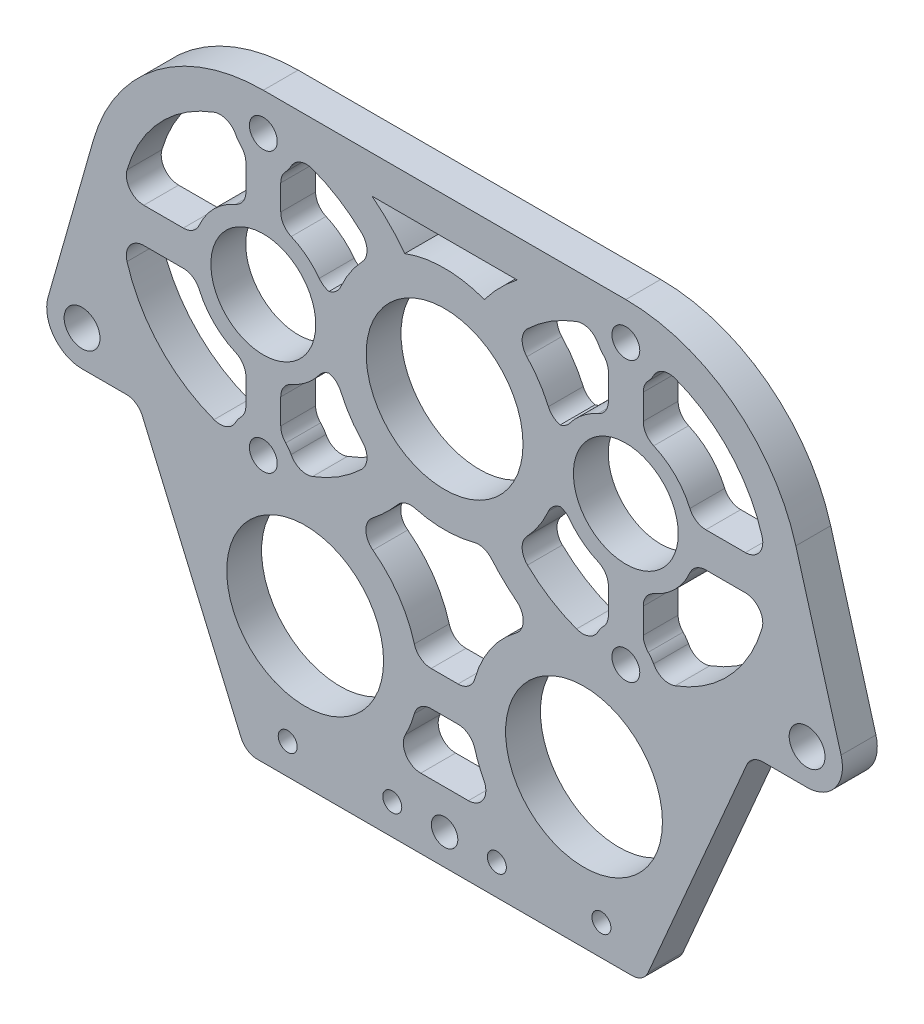
from build123d import *

# Parameters (mm, degrees)
SKETCH1_R           = 9.5504
SKETCH1_R_2         = 2.54
SKETCH1_R_3         = 3.2639
SKETCH1_R_4         = 14.2875
SKETCH1_R_5         = 1.7272
SKETCH1_R_6         = 2.413
BOSS_EXTRUDE1_DEPTH = 6.35
FILLET1_R           = 3.175
FILLET2_R           = 3.175
FILLET3_R           = 3.175


with BuildPart() as part:
    # Sketch1 → Boss-Extrude1 (new body)
    with BuildSketch(Plane.XY):
        with BuildLine():
            Line((-88.729603024, -57.047479146), (-96.969555254, -85.936940817))
            ThreePointArc((-96.969555254, -85.936940817), (-95.917203646, -91.581675778), (-90.777596546, -94.141932707))
            Line((-90.777596546, -94.141932707), (-82.731084461, -94.141932707))
            ThreePointArc((-82.731084461, -94.141932707), (-81.056984084, -94.611428847), (-79.87115572, -95.882982931))
            Line((-79.87115572, -95.882982931), (-60.977424177, -139.773032707))
            Line((-60.977424177, -139.773032707), (11.502231084, -139.773032707))
            Line((11.502231084, -139.773032707), (30.395962627, -95.882982931))
            ThreePointArc((30.395962627, -95.882982931), (31.581790992, -94.611428847), (33.255891369, -94.141932707))
            Line((33.255891369, -94.141932707), (41.302403454, -94.141932707))
            ThreePointArc((41.302403454, -94.141932707), (46.442010554, -91.581675778), (47.494362162, -85.936940817))
            Line((47.494362162, -85.936940817), (39.254409932, -57.047479146))
            ThreePointArc((39.254409932, -57.047479146), (39.214953717, -56.910298001), (39.174889904, -56.773293074))
            ThreePointArc((39.174889904, -56.773293074), (27.569139848, -40.087517091), (8.282403454, -33.674222013))
            Line((8.282403454, -33.674222013), (-57.757596546, -33.674222013))
            ThreePointArc((-57.757596546, -33.674222013), (-77.04433294, -40.087517091), (-88.650082996, -56.773293074))
            ThreePointArc((-88.650082996, -56.773293074), (-88.69014681, -56.910298001), (-88.729603024, -57.047479146))
        make_face()
        with Locations((-57.757596546, -65.881422013)):
            Circle(SKETCH1_R, mode=Mode.SUBTRACT)
        with Locations((-57.757596546, -40.481422013)):
            Circle(SKETCH1_R_2, mode=Mode.SUBTRACT)
        with Locations((-57.757596546, -91.281422013)):
            Circle(SKETCH1_R_2, mode=Mode.SUBTRACT)
        with Locations((-90.777596546, -87.703032707)):
            Circle(SKETCH1_R_3, mode=Mode.SUBTRACT)
        with Locations((-50.137596546, -112.785532707)):
            Circle(SKETCH1_R_4, mode=Mode.SUBTRACT)
        with Locations((-24.737596546, -65.881422013)):
            Circle(SKETCH1_R_4, mode=Mode.SUBTRACT)
        with Locations((-15.212596546, -134.185032707)):
            Circle(SKETCH1_R_5, mode=Mode.SUBTRACT)
        with Locations((3.837403454, -134.185032707)):
            Circle(SKETCH1_R_5, mode=Mode.SUBTRACT)
        with Locations((0.662403454, -112.785532707)):
            Circle(SKETCH1_R_4, mode=Mode.SUBTRACT)
        with Locations((-53.312596546, -134.185032707)):
            Circle(SKETCH1_R_5, mode=Mode.SUBTRACT)
        with Locations((-24.737596546, -134.185032707)):
            Circle(SKETCH1_R_6, mode=Mode.SUBTRACT)
        with Locations((-34.262596546, -134.185032707)):
            Circle(SKETCH1_R_5, mode=Mode.SUBTRACT)
        with Locations((41.302403454, -87.703032707)):
            Circle(SKETCH1_R_3, mode=Mode.SUBTRACT)
        with Locations((8.282403454, -91.281422013)):
            Circle(SKETCH1_R_2, mode=Mode.SUBTRACT)
        with Locations((8.282403454, -40.481422013)):
            Circle(SKETCH1_R_2, mode=Mode.SUBTRACT)
        with Locations((8.282403454, -65.881422013)):
            Circle(SKETCH1_R, mode=Mode.SUBTRACT)
        with BuildLine():
            Line((-70.080549932, -62.706422013), (-83.419127421, -62.706422013))
            ThreePointArc((-83.419127421, -62.706422013), (-76.929294637, -48.5308951), (-63.469709832, -40.663044713))
            ThreePointArc((-63.469709832, -40.663044713), (-62.754302005, -43.255256823), (-60.932596546, -45.233326894))
            Line((-60.932596546, -45.233326894), (-60.932596546, -53.558468627))
            ThreePointArc((-60.932596546, -53.558468627), (-66.755813179, -56.88320538), (-70.080549932, -62.706422013))
        make_face(mode=Mode.SUBTRACT)
        with BuildLine():
            Line((-60.932596546, -86.529517132), (-60.932596546, -78.204375399))
            ThreePointArc((-60.932596546, -78.204375399), (-66.755813179, -74.879638646), (-70.080549932, -69.056422013))
            Line((-70.080549932, -69.056422013), (-83.419127421, -69.056422013))
            ThreePointArc((-83.419127421, -69.056422013), (-76.929294637, -83.231948926), (-63.469709832, -91.099799313))
            ThreePointArc((-63.469709832, -91.099799313), (-62.754302005, -88.507587203), (-60.932596546, -86.529517132))
        make_face(mode=Mode.SUBTRACT)
        with BuildLine():
            Line((-54.582596546, -45.233326894), (-54.582596546, -53.558468627))
            ThreePointArc((-54.582596546, -53.558468627), (-50.053751715, -55.75291867), (-46.729754275, -59.531422013))
            Line((-46.729754275, -59.531422013), (-44.373887088, -59.531422013))
            ThreePointArc((-44.373887088, -59.531422013), (-41.698150512, -54.123615439), (-37.572726988, -49.720796011))
            ThreePointArc((-37.572726988, -49.720796011), (-44.03993841, -43.962921903), (-52.04548326, -40.663044713))
            ThreePointArc((-52.04548326, -40.663044713), (-52.760891087, -43.255256823), (-54.582596546, -45.233326894))
        make_face(mode=Mode.SUBTRACT)
        with BuildLine():
            Line((-54.582596546, -86.529517132), (-54.582596546, -78.204375399))
            ThreePointArc((-54.582596546, -78.204375399), (-50.053751715, -76.009925356), (-46.729754275, -72.231422013))
            Line((-46.729754275, -72.231422013), (-44.373887088, -72.231422013))
            ThreePointArc((-44.373887088, -72.231422013), (-41.698150512, -77.639228587), (-37.572726988, -82.042048015))
            ThreePointArc((-37.572726988, -82.042048015), (-44.03993841, -87.799922123), (-52.04548326, -91.099799313))
            ThreePointArc((-52.04548326, -91.099799313), (-52.760891087, -88.507587203), (-54.582596546, -86.529517132))
        make_face(mode=Mode.SUBTRACT)
        with BuildLine():
            Line((-29.745789828, -109.610532707), (-19.729403265, -109.610532707))
            ThreePointArc((-19.729403265, -109.610532707), (-15.691684208, -100.197831448), (-7.625900666, -93.885521568))
            ThreePointArc((-7.625900666, -93.885521568), (-13.003173569, -90.052229667), (-17.485581488, -85.202775067))
            ThreePointArc((-17.485581488, -85.202775067), (-24.737596546, -86.518922013), (-31.989611604, -85.202775067))
            ThreePointArc((-31.989611604, -85.202775067), (-36.472019523, -90.052229667), (-41.849292426, -93.885521568))
            ThreePointArc((-41.849292426, -93.885521568), (-33.783508884, -100.197831448), (-29.745789828, -109.610532707))
        make_face(mode=Mode.SUBTRACT)
        with BuildLine():
            Line((-14.229666584, -127.073032707), (-35.245526509, -127.073032707))
            ThreePointArc((-35.245526509, -127.073032707), (-31.641383318, -121.939575664), (-29.745789828, -115.960532707))
            Line((-29.745789828, -115.960532707), (-19.729403265, -115.960532707))
            ThreePointArc((-19.729403265, -115.960532707), (-17.833809775, -121.939575664), (-14.229666584, -127.073032707))
        make_face(mode=Mode.SUBTRACT)
        with BuildLine():
            Line((-11.520215864, -40.481422013), (-37.954977229, -40.481422013))
            ThreePointArc((-37.954977229, -40.481422013), (-34.770481018, -43.32269307), (-31.989611604, -46.560068959))
            ThreePointArc((-31.989611604, -46.560068959), (-24.737596546, -45.243922013), (-17.485581488, -46.560068959))
            ThreePointArc((-17.485581488, -46.560068959), (-14.704712075, -43.32269307), (-11.520215864, -40.481422013))
        make_face(mode=Mode.SUBTRACT)
        with BuildLine():
            Line((-2.745438817, -72.231422013), (-5.101306004, -72.231422013))
            ThreePointArc((-5.101306004, -72.231422013), (-7.77704258, -77.639228587), (-11.902466104, -82.042048015))
            ThreePointArc((-11.902466104, -82.042048015), (-5.435254683, -87.799922123), (2.570290168, -91.099799313))
            ThreePointArc((2.570290168, -91.099799313), (3.285697995, -88.507587203), (5.107403454, -86.529517132))
            Line((5.107403454, -86.529517132), (5.107403454, -78.204375399))
            ThreePointArc((5.107403454, -78.204375399), (0.578558623, -76.009925356), (-2.745438817, -72.231422013))
        make_face(mode=Mode.SUBTRACT)
        with BuildLine():
            Line((20.60535684, -69.056422013), (33.943934329, -69.056422013))
            ThreePointArc((33.943934329, -69.056422013), (27.454101545, -83.231948926), (13.99451674, -91.099799313))
            ThreePointArc((13.99451674, -91.099799313), (13.279108913, -88.507587203), (11.457403454, -86.529517132))
            Line((11.457403454, -86.529517132), (11.457403454, -78.204375399))
            ThreePointArc((11.457403454, -78.204375399), (17.280620087, -74.879638646), (20.60535684, -69.056422013))
        make_face(mode=Mode.SUBTRACT)
        with BuildLine():
            Line((-2.745438817, -59.531422013), (-5.101306004, -59.531422013))
            ThreePointArc((-5.101306004, -59.531422013), (-7.77704258, -54.123615439), (-11.902466104, -49.720796011))
            ThreePointArc((-11.902466104, -49.720796011), (-5.435254683, -43.962921903), (2.570290168, -40.663044713))
            ThreePointArc((2.570290168, -40.663044713), (3.285697995, -43.255256823), (5.107403454, -45.233326894))
            Line((5.107403454, -45.233326894), (5.107403454, -53.558468627))
            ThreePointArc((5.107403454, -53.558468627), (0.578558623, -55.75291867), (-2.745438817, -59.531422013))
        make_face(mode=Mode.SUBTRACT)
        with BuildLine():
            Line((11.457403454, -45.233326894), (11.457403454, -53.558468627))
            ThreePointArc((11.457403454, -53.558468627), (17.280620087, -56.88320538), (20.60535684, -62.706422013))
            Line((20.60535684, -62.706422013), (33.943934329, -62.706422013))
            ThreePointArc((33.943934329, -62.706422013), (27.454101545, -48.5308951), (13.99451674, -40.663044713))
            ThreePointArc((13.99451674, -40.663044713), (13.279108913, -43.255256823), (11.457403454, -45.233326894))
        make_face(mode=Mode.SUBTRACT)
    extrude(amount=BOSS_EXTRUDE1_DEPTH)

    # Fillet1
    # the kernel refuses this fillet: 3.175 mm, written as the material it adds along each edge
    with BuildSketch(Plane(origin=(-83.419127421, -62.706422013, 0), x_dir=(0.20202386048271717, 0.9793806000711163, 0), z_dir=(0, 0, 1)), Plane(origin=(33.943934329, -69.056422013, 0), x_dir=(-0.20202386048271942, -0.9793806000711157, 0), z_dir=(0, 0, 1))) as fillet1_piece_1:
        with BuildLine():
            CenterArc((3.894663293, -3.164763171), FILLET1_R, 85.397802543, 106.257531351)
            Line((0.785129888, -3.806188928), (0, 0))
            ThreePointArc((0, 0), (2.074708128, 0.083368736), (4.149416256, 0))
        make_face()
    extrude(amount=6.35)
    with BuildSketch(Plane(origin=(-63.469709832, -40.663044713, 0), x_dir=(0.2545165801786531, -0.9670684104106406, 0), z_dir=(0, 0, 1)), Plane(origin=(2.570290168, -40.663044713, 0), x_dir=(0.25451658017865375, -0.9670684104106404, 0), z_dir=(0, 0, 1))) as fillet1_piece_2:
        with BuildLine():
            CenterArc((3.26647524, -3.094572391), FILLET1_R, 102.923775638, 82.642434377)
            ThreePointArc((0.106446076, -3.402534536), (-0.002832337, -1.703020924), (0, 0))
            ThreePointArc((0, 0), (1.278185963, -0.144769696), (2.556371927, 0))
        make_face()
    extrude(amount=6.35)
    with BuildSketch(Plane(origin=(-60.932596546, -45.233326894, 0), x_dir=(0, -1, 0), z_dir=(0, 0, 1)), Plane(origin=(11.457403454, -86.529517132, 0), x_dir=(0, 1, 0), z_dir=(0, 0, 1)), Plane(origin=(5.107403454, -45.233326894, 0), x_dir=(0, -1, 0), z_dir=(0, 0, 1)), Plane(origin=(-54.582596546, -86.529517132, 0), x_dir=(0, 1, 0), z_dir=(0, 0, 1))) as fillet1_piece_3:
        with BuildLine():
            CenterArc((1.469799065, -3.175), FILLET1_R, 90, 44.415308597)
            ThreePointArc((-0.752238058, -0.907142857), (-0.352674396, -0.473012628), (0, 0))
            Line((0, 0), (1.469799065, 0))
        make_face()
    extrude(amount=6.35)
    with BuildSketch(Plane(origin=(-60.932596546, -53.558468627, 0), x_dir=(-0.9455577058217259, -0.32545448984636016, 0), z_dir=(0, 0, 1)), Plane(origin=(11.457403454, -78.204375399, 0), x_dir=(0.9455577058217268, 0.3254544898463573, 0), z_dir=(0, 0, 1)), Plane(origin=(20.60535684, -62.706422013, 0), x_dir=(-0.3254544898463612, 0.9455577058217255, 0), z_dir=(0, 0, 1)), Plane(origin=(5.107403454, -53.558468627, 0), x_dir=(-0.9455577058217245, -0.3254544898463644, 0), z_dir=(0, 0, 1)), Plane(origin=(-54.582596546, -78.204375399, 0), x_dir=(0.9455577058217265, 0.32545448984635805, 0), z_dir=(0, 0, 1)), Plane(origin=(-70.080549932, -69.056422013, 0), x_dir=(0.325454489846357, -0.9455577058217269, 0), z_dir=(0, 0, 1))) as fillet1_piece_4:
        with BuildLine():
            CenterArc((2.26843008, -3.165015354), FILLET1_R, 94.545126593, 66.461761022)
            Line((-0.733715636, -2.131697349), (0, 0))
            ThreePointArc((0, 0), (1.008414792, -0.040018462), (2.016829583, 0))
        make_face()
    extrude(amount=6.35)
    with BuildSketch(Plane(origin=(-70.080549932, -62.706422013, 0), x_dir=(0.32545448984635805, 0.9455577058217265, 0), z_dir=(0, 0, 1)), Plane(origin=(5.107403454, -78.204375399, 0), x_dir=(-0.9455577058217269, 0.325454489846357, 0), z_dir=(0, 0, 1))) as fillet1_piece_5:
        with BuildLine():
            CenterArc((2.26843008, 3.165015354), FILLET1_R, 198.993112385, 66.461761022)
            Line((-0.733715636, 2.131697349), (0, 0))
            ThreePointArc((0, 0), (1.008414792, 0.040018462), (2.016829583, 0))
        make_face()
    extrude(amount=6.35)
    with BuildSketch(Plane(origin=(-5.101306004, -59.531422013, 0), x_dir=(-0.35427791260671704, 0.9351401823464905, 0), z_dir=(0, 0, 1)), Plane(origin=(-44.373887088, -72.231422013, 0), x_dir=(0.35427791260671626, -0.9351401823464908, 0), z_dir=(0, 0, 1))) as fillet1_piece_6:
        with BuildLine():
            CenterArc((2.193829867, -3.171130625), FILLET1_R, 92.828982669, 66.421821522)
            Line((-0.775240212, -2.046298253), (0, 0))
            ThreePointArc((0, 0), (1.018563867, -0.025150937), (2.037127733, 0))
        make_face()
    extrude(amount=6.35)
    with BuildSketch(Plane(origin=(-2.745438817, -59.531422013, 0), x_dir=(0.5500091242256826, 0.8351586455689107, 0), z_dir=(0, 0, 1))) as fillet1_piece_7:
        with BuildLine():
            CenterArc((1.714471741, 3.169300338), FILLET1_R, 213.367638931, 53.198716661)
            Line((-0.937156959, 1.423021368), (0, 0))
            ThreePointArc((0, 0), (0.76215647, 0.022844246), (1.524312941, 0))
        make_face()
    extrude(amount=6.35)
    with BuildSketch(Plane(origin=(-2.745438817, -72.231422013, 0), x_dir=(0.5500091242256772, -0.8351586455689144, 0), z_dir=(0, 0, 1)), Plane(origin=(-46.729754275, -59.531422013, 0), x_dir=(-0.5500091242256768, 0.8351586455689146, 0), z_dir=(0, 0, 1))) as fillet1_piece_8:
        with BuildLine():
            CenterArc((1.714471741, -3.169300338), FILLET1_R, 93.433644408, 53.198716661)
            Line((-0.937156959, -1.423021368), (0, 0))
            ThreePointArc((0, 0), (0.76215647, -0.022844246), (1.524312941, 0))
        make_face()
    extrude(amount=6.35)
    with BuildSketch(Plane(origin=(-5.101306004, -72.231422013, 0), x_dir=(1, 0, 0), z_dir=(0, 0, 1)), Plane(origin=(-44.373887088, -59.531422013, 0), x_dir=(-1, 0, 0), z_dir=(0, 0, 1))) as fillet1_piece_9:
        with BuildLine():
            CenterArc((2.188226205, -3.175), FILLET1_R, 90, 66.421821522)
            ThreePointArc((-0.721709361, -1.905), (-0.337335029, -0.961410421), (0, 0))
            Line((0, 0), (2.188226205, 0))
        make_face()
    extrude(amount=6.35)
    with BuildSketch(Plane(origin=(-11.902466104, -82.042048015, 0), x_dir=(0.736851809317772, 0.6760542959741662, 0), z_dir=(0, 0, 1))) as fillet1_piece_10:
        with BuildLine():
            CenterArc((3.161569482, -3.166958705), FILLET1_R, 94.078687757, 89.53308235)
            ThreePointArc((-0.00712436, -3.366969545), (-0.058423827, -1.683368687), (0, 0))
            ThreePointArc((0, 0), (1.467871545, -0.052268416), (2.93574309, 0))
        make_face()
    extrude(amount=6.35)
    with BuildSketch(Plane(origin=(2.570290168, -91.099799313, 0), x_dir=(-0.9586370257325714, 0.28463143342682545, 0), z_dir=(0, 0, 1)), Plane(origin=(13.99451674, -40.663044713, 0), x_dir=(0.9586370257325708, -0.2846314334268272, 0), z_dir=(0, 0, 1)), Plane(origin=(-52.04548326, -40.663044713, 0), x_dir=(0.9586370257325701, -0.2846314334268294, 0), z_dir=(0, 0, 1))) as fillet1_piece_11:
        with BuildLine():
            CenterArc((3.195198736, -3.168113605), FILLET1_R, 86.225666688, 82.642434377)
            ThreePointArc((0.079935323, -2.55512187), (0.184666565, -1.273034124), (0, 0))
            ThreePointArc((0, 0), (1.702099588, 0.056082799), (3.404199176, 0))
        make_face()
    extrude(amount=6.35)
    with BuildSketch(Plane(origin=(5.107403454, -86.529517132, 0), x_dir=(-0.769769113805321, -0.638322419652773, 0), z_dir=(0, 0, 1)), Plane(origin=(-60.932596546, -86.529517132, 0), x_dir=(-0.7697691138053148, -0.6383224196527804, 0), z_dir=(0, 0, 1)), Plane(origin=(-54.582596546, -45.233326894, 0), x_dir=(0.7697691138053148, 0.6383224196527804, 0), z_dir=(0, 0, 1))) as fillet1_piece_12:
        with BuildLine():
            CenterArc((1.50581124, -3.158079606), FILLET1_R, 95.917851403, 44.415308597)
            Line((-0.938205696, -1.131405924), (0, 0))
            ThreePointArc((0, 0), (0.589230485, -0.030456708), (1.178460971, 0))
        make_face()
    extrude(amount=6.35)
    with BuildSketch(Plane(origin=(13.99451674, -91.099799313, 0), x_dir=(0.9586370257325707, 0.28463143342682784, 0), z_dir=(0, 0, 1)), Plane(origin=(-52.04548326, -91.099799313, 0), x_dir=(0.9586370257325715, 0.284631433426825, 0), z_dir=(0, 0, 1))) as fillet1_piece_13:
        with BuildLine():
            CenterArc((3.195198736, 3.168113605), FILLET1_R, 191.131898935, 82.642434377)
            ThreePointArc((0.079935323, 2.55512187), (0.184666565, 1.273034124), (0, 0))
            ThreePointArc((0, 0), (1.702099588, -0.056082799), (3.404199176, 0))
        make_face()
    extrude(amount=6.35)
    with BuildSketch(Plane(origin=(20.60535684, -69.056422013, 0), x_dir=(1, 0, 0), z_dir=(0, 0, 1)), Plane(origin=(11.457403454, -53.558468627, 0), x_dir=(0, 1, 0), z_dir=(0, 0, 1)), Plane(origin=(-60.932596546, -78.204375399, 0), x_dir=(0, -1, 0), z_dir=(0, 0, 1)), Plane(origin=(-54.582596546, -53.558468627, 0), x_dir=(0, 1, 0), z_dir=(0, 0, 1))) as fillet1_piece_14:
        with BuildLine():
            CenterArc((2.254433902, -3.175), FILLET1_R, 90, 66.461761022)
            ThreePointArc((-0.656386243, -1.907028754), (-0.290353357, -0.966538565), (0, 0))
            Line((0, 0), (2.254433902, 0))
        make_face()
    extrude(amount=6.35)
    with BuildSketch(Plane(origin=(33.943934329, -62.706422013, 0), x_dir=(-1, 0, 0), z_dir=(0, 0, 1)), Plane(origin=(-83.419127421, -69.056422013, 0), x_dir=(1, 0, 0), z_dir=(0, 0, 1))) as fillet1_piece_15:
        with BuildLine():
            CenterArc((3.886322567, -3.175), FILLET1_R, 90, 106.257531351)
            ThreePointArc((0.838281091, -4.063857783), (0.337490823, -2.048771365), (0, 0))
            Line((0, 0), (3.886322567, 0))
        make_face()
    extrude(amount=6.35)
    with BuildSketch(Plane(origin=(11.457403454, -45.233326894, 0), x_dir=(0, -1, 0), z_dir=(0, 0, 1))) as fillet1_piece_16:
        with BuildLine():
            CenterArc((1.469799065, 3.175), FILLET1_R, 225.584691403, 44.415308597)
            ThreePointArc((-0.752238058, 0.907142857), (-0.352674396, 0.473012628), (0, 0))
            Line((0, 0), (1.469799065, 0))
        make_face()
    extrude(amount=6.35)
    with BuildSketch(Plane(origin=(-11.902466104, -49.720796011, 0), x_dir=(0.6744936398427407, 0.7382806578881037, 0), z_dir=(0, 0, 1)), Plane(origin=(-37.572726988, -82.042048015, 0), x_dir=(-0.6744936398427365, -0.7382806578881076, 0), z_dir=(0, 0, 1))) as fillet1_piece_17:
        with BuildLine():
            CenterArc((3.160261888, -3.168263535), FILLET1_R, 86.266994712, 89.53308235)
            ThreePointArc((-0.00621189, -2.935736518), (0.049162354, -1.467978857), (0, 0))
            ThreePointArc((0, 0), (1.683488541, 0.054861769), (3.366977082, 0))
        make_face()
    extrude(amount=6.35)
    with BuildSketch(Plane(origin=(-46.729754275, -72.231422013, 0), x_dir=(1, 0, 0), z_dir=(0, 0, 1))) as fillet1_piece_18:
        with BuildLine():
            CenterArc((1.703893477, -3.175), FILLET1_R, 90, 53.198716661)
            ThreePointArc((-0.838386026, -1.273043131), (-0.400114443, -0.649086109), (0, 0))
            Line((0, 0), (1.703893477, 0))
        make_face()
    extrude(amount=6.35)
    with BuildSketch(Plane(origin=(-63.469709832, -91.099799313, 0), x_dir=(0.25451658017866036, 0.9670684104106387, 0), z_dir=(0, 0, 1))) as fillet1_piece_19:
        with BuildLine():
            CenterArc((3.26647524, 3.094572391), FILLET1_R, 174.433789984, 82.642434377)
            ThreePointArc((0.106446076, 3.402534536), (-0.002832337, 1.703020924), (0, 0))
            ThreePointArc((0, 0), (1.278185963, 0.144769696), (2.556371927, 0))
        make_face()
    extrude(amount=6.35)
    with BuildSketch(Plane(origin=(-37.572726988, -49.720796011, 0), x_dir=(-0.6744936398427409, 0.7382806578881034, 0), z_dir=(0, 0, 1))) as fillet1_piece_20:
        with BuildLine():
            CenterArc((3.160261888, 3.168263535), FILLET1_R, 184.199922939, 89.53308235)
            ThreePointArc((-0.00621189, 2.935736518), (0.049162354, 1.467978857), (0, 0))
            ThreePointArc((0, 0), (1.683488541, -0.054861769), (3.366977082, 0))
        make_face()
    extrude(amount=6.35)

    # Fillet2
    fillet2_edges = [part.edges().sort_by_distance(p)[0] for p in [
        (-17.485581488, -85.202775067, 3.175),
        (-31.989611604, -85.202775067, 3.175),
        (-41.849292426, -93.885521568, 3.175),
        (-29.745789828, -109.610532707, 3.175),
        (-19.729403265, -109.610532707, 3.175),
        (-7.625900666, -93.885521568, 3.175),
        (-19.729403265, -115.960532707, 3.175),
        (-29.745789828, -115.960532707, 3.175),
        (-35.245526509, -127.073032707, 3.175),
        (-14.229666584, -127.073032707, 3.175),
    ]]
    fillet(fillet2_edges, radius=FILLET2_R)

    # Fillet3
    fillet3_edges = [part.edges().sort_by_distance(p)[0] for p in [
        (11.502231084, -139.773032707, 3.175),
        (-60.977424177, -139.773032707, 3.175),
    ]]
    fillet(fillet3_edges, radius=FILLET3_R)


solid = part.part
